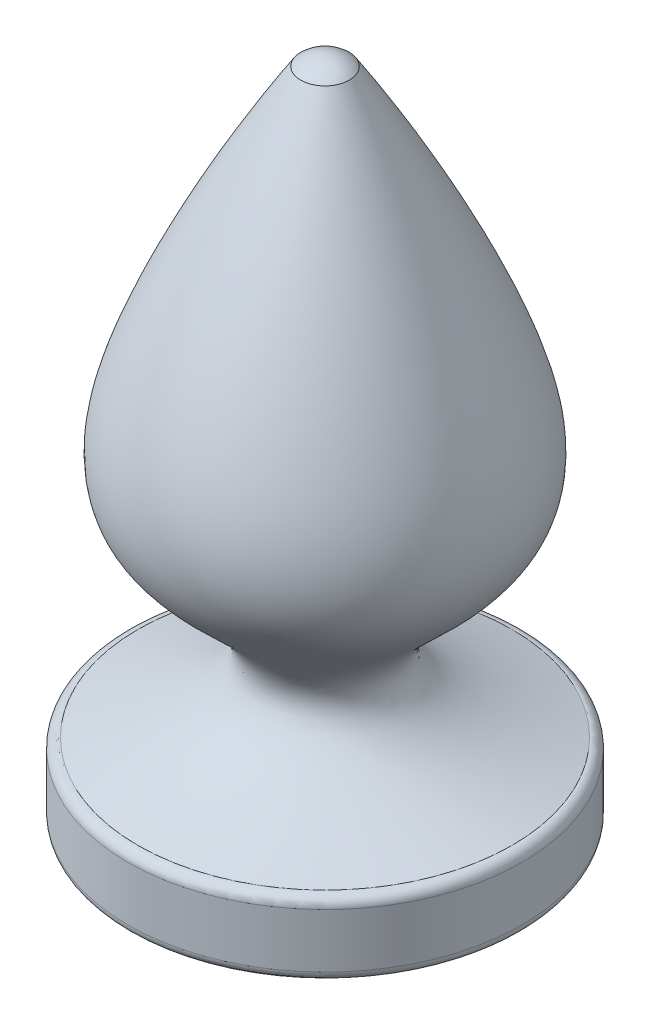
from build123d import *


with BuildPart() as part:
    # Sketch1 → Revolve1 (revolve)
    with BuildSketch(Plane.XY):
        with BuildLine():
            Line((0, -40.570542879), (0, 40.570542879))
            Line((0, 40.570542879), (0, 45.154457121))
            ThreePointArc((0, 45.154457121), (1.67960061, 44.835658536), (3.125578046, 43.923605905))
            add(Edge.make_bspline(
                [(3.125578046, 43.923605905), (6.229269045, 39.128554594), (18.662552576, 18.479481976), (26.405775725, -12.510106853), (-5.615735597, -21.473896279), (24.13, -31.045542879)],
                knots=[0, 0, 0, 0, 0.389545729, 0.603250395, 1, 1, 1, 1], degree=3))
            ThreePointArc((24.13, -31.045542879), (25.028025612, -31.417517267), (25.4, -32.315542879))
            Line((25.4, -32.315542879), (25.4, -39.300542879))
            ThreePointArc((25.4, -39.300542879), (25.028025612, -40.198568491), (24.13, -40.570542879))
            Line((24.13, -40.570542879), (0, -40.570542879))
        make_face()
    revolve(axis=Axis((0, -40.570542879, 0), (0, 1, 0)))


solid = part.part
